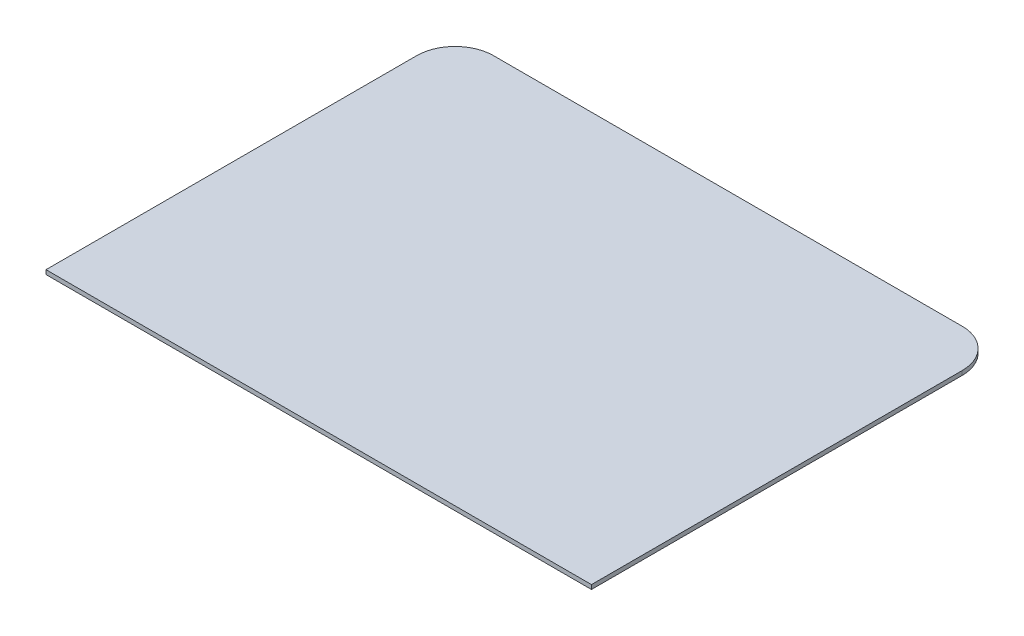
from build123d import *

# Parameters (mm, degrees)
SKETCH1_W           = 406.4
SKETCH1_H           = 304.8
BOSS_EXTRUDE1_DEPTH = 3.175
FILLET1_R           = 28.575


with BuildPart() as part:
    # Sketch1 → Boss-Extrude1 (new body)
    with BuildSketch(Plane(origin=(0, 0, 0), x_dir=(1, 0, 0), z_dir=(0, 1, 0))):
        Rectangle(SKETCH1_W, SKETCH1_H)
    extrude(amount=BOSS_EXTRUDE1_DEPTH)

    # Fillet1
    fillet1_edges = [part.edges().sort_by_distance(p)[0] for p in [
        (-203.2, 1.5875, -152.4),
        (203.2, 1.5875, -152.4),
    ]]
    fillet(fillet1_edges, radius=FILLET1_R)


solid = part.part
